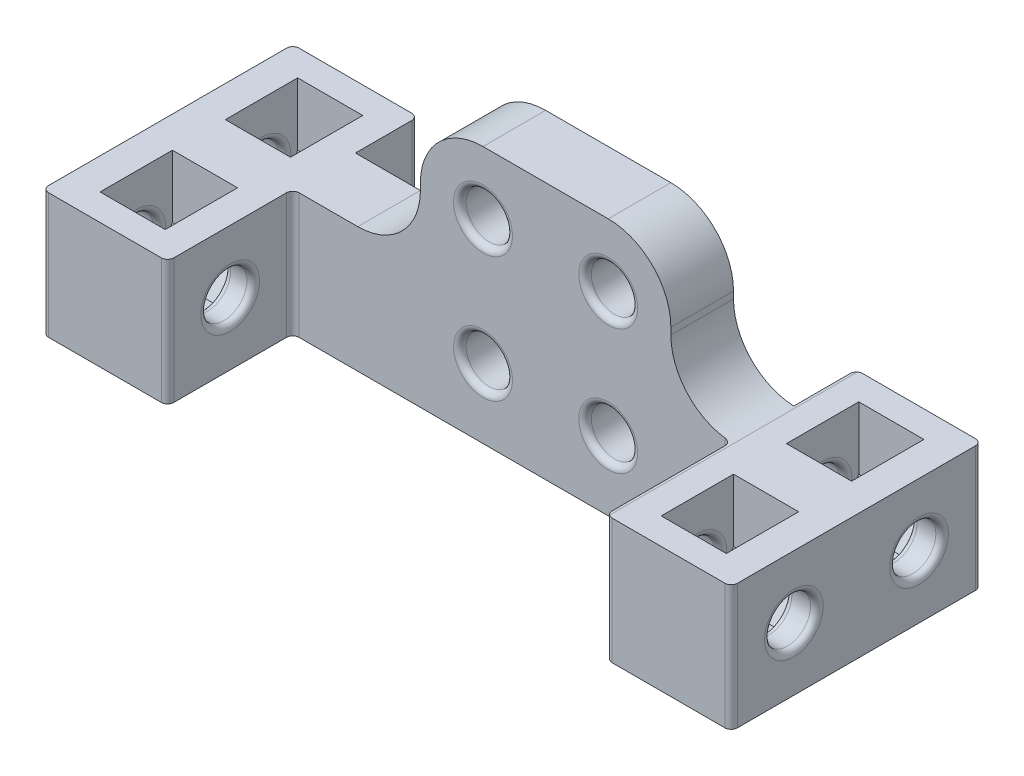
from build123d import *

# Parameters (mm, degrees)
SKETCH1_R           = 2.3495
BOSS_EXTRUDE1_DEPTH = 3.175
SKETCH2_W           = 12.7
SKETCH2_H           = 12.7
BOSS_EXTRUDE2_DEPTH = 12.7
SKETCH4_R           = 2.3368
CUT_EXTRUDE1_DEPTH  = 19.05
CUT_EXTRUDE2_START  = -50.8
SKETCH4_2_R         = 2.3368
CUT_EXTRUDE2_DEPTH  = 19.05
CUT_EXTRUDE3_START  = -3.175
CUT_EXTRUDE3_DEPTH  = 6.604
FILLET1_R           = 0.635
FILLET2_R           = 6.35
FILLET3_R           = 0.635


with BuildPart() as part:
    # Sketch1 → Boss-Extrude1 (new, symmetric)
    with BuildSketch(Plane.XY):
        Polygon((-34.925, -13.042622959), (34.925, -13.042622959), (34.925, -0.342622959), (16.110000038, -0.342622959), (16.110000038, 13.042622959), (-9.289999962, 13.042622959), (-9.289999962, -0.342622959), (-34.925, -0.342622959), align=None)
        with Locations((-2.939999962, 6.692622959)):
            Circle(SKETCH1_R, mode=Mode.SUBTRACT)
        with Locations((9.760000038, 6.692622959)):
            Circle(SKETCH1_R, mode=Mode.SUBTRACT)
        with Locations((9.760000038, -6.007377041)):
            Circle(SKETCH1_R, mode=Mode.SUBTRACT)
        with Locations((-2.939999962, -6.007377041)):
            Circle(SKETCH1_R, mode=Mode.SUBTRACT)
    extrude(amount=BOSS_EXTRUDE1_DEPTH, both=True)

    # Sketch2 → Boss-Extrude2 (add, symmetric)
    with BuildSketch(Plane(origin=(0, 0, -3.175), x_dir=(-1, 0, 0), z_dir=(0, 0, -1))):
        with Locations((28.575, -6.692622959)):
            Rectangle(SKETCH2_W, SKETCH2_H)
        with Locations((-28.575, -6.692622959)):
            Rectangle(SKETCH2_W, SKETCH2_H)
    extrude(amount=BOSS_EXTRUDE2_DEPTH, both=True)

    # Sketch4 → Cut-Extrude1 (cut)
    with BuildSketch(Plane.ZY.offset(34.925)):
        with Locations((-9.525, -6.692622959)):
            Circle(SKETCH4_R)
        with Locations((3.175, -6.692622959)):
            Circle(SKETCH4_R)
    extrude(amount=-CUT_EXTRUDE1_DEPTH, mode=Mode.SUBTRACT)

    # Sketch4<2> → Cut-Extrude2 (cut)
    with BuildSketch(Plane.ZY.offset(34.925).offset(CUT_EXTRUDE2_START)):
        with Locations((-9.525, -6.692622959)):
            Circle(SKETCH4_2_R)
        with Locations((3.175, -6.692622959)):
            Circle(SKETCH4_2_R)
    extrude(amount=-CUT_EXTRUDE2_DEPTH, mode=Mode.SUBTRACT)

    # Sketch5 → Cut-Extrude3 (cut)
    with BuildSketch(Plane.ZY.offset(34.925).offset(CUT_EXTRUDE3_START)):
        Polygon((-13.191174209, -6.692622959), (-13.191174209, 2.602121023), (-5.858825791, 2.602121023), (-5.858825791, -6.692622959), (-7.691912895, -9.867622959), (-11.358087105, -9.867622959), align=None)
        Polygon((-0.491174209, -6.692622959), (1.341912895, -9.867622959), (5.008087105, -9.867622959), (6.841174209, -6.692622959), (6.841174209, 3.296019963), (-0.491174209, 3.296019963), align=None)
    cut_extrude3 = extrude(amount=-CUT_EXTRUDE3_DEPTH, mode=Mode.SUBTRACT)

    # Mirror1: Cut-Extrude3 across plane
    add(cut_extrude3.mirror(Plane(origin=(0, 0, 0), x_dir=(0, 0, 1), z_dir=(1, 0, 0))), mode=Mode.SUBTRACT)

    # Fillet1
    fillet1_edges = [part.edges().sort_by_distance(p)[0] for p in [
        (22.225, -5.040255833, 4.827367126),
        (15.875, -6.692622959, 3.175),
        (34.925, -6.692622959, -11.8618),
        (22.225, -6.692622959, -11.8618),
        (19.05, -9.029422959, 3.175),
        (19.05, -4.355822959, 3.175),
        (34.925, -6.692622959, 0.8382),
        (15.875, -6.692622959, 0.8382),
        (-31.75, -6.692622959, -11.8618),
        (-25.146, -6.692622959, -11.8618),
        (-25.146, -6.692622959, 0.8382),
        (-31.75, -6.692622959, 0.8382),
        (25.146, -6.692622959, -11.8618),
        (31.75, -6.692622959, -11.8618),
        (25.146, -6.692622959, 0.8382),
        (31.75, -6.692622959, 0.8382),
        (-5.289499962, 6.692622959, -3.175),
        (-5.289499962, 6.692622959, 3.175),
        (7.410500038, 6.692622959, -3.175),
        (7.410500038, 6.692622959, 3.175),
        (7.410500038, -6.007377041, -3.175),
        (7.410500038, -6.007377041, 3.175),
        (-5.289499962, -6.007377041, -3.175),
        (-5.289499962, -6.007377041, 3.175),
        (-22.225, -8.344990085, 4.827367126),
        (-15.875, -6.692622959, 3.175),
        (-22.225, -6.692622959, -11.8618),
        (-34.925, -6.692622959, -11.8618),
        (-19.05, -4.355822959, 3.175),
        (-19.05, -9.029422959, 3.175),
        (-15.875, -6.692622959, 0.8382),
        (-34.925, -6.692622959, 0.8382),
    ]]
    fillet(fillet1_edges, radius=FILLET1_R)

    # Fillet2
    # the kernel refuses this fillet: 6.35 mm, written as the material it adds along each edge
    with BuildSketch(Plane(origin=(16.110000038, -0.342622959, -19.05), x_dir=(0, 1, 0), z_dir=(0, 0, 1))) as fillet2_piece_1_section:
        with BuildLine():
            CenterArc((FILLET2_R, -FILLET2_R), FILLET2_R, 90, 90)
            Line((0, -FILLET2_R), (0, 0))
            Line((0, 0), (FILLET2_R, 0))
        make_face()
    fillet2_piece_1 = extrude(amount=22.225, mode=Mode.PRIVATE)
    fillet2_piece_1 = split(fillet2_piece_1, bisect_by=Plane(origin=(22.34183688, -0.405391526, -3.175), z_dir=(0, 0, -1)), keep=Keep.TOP, mode=Mode.PRIVATE)
    fillet2_piece_1 = split(fillet2_piece_1, bisect_by=Plane(origin=(22.225, -0.405391526, -9.525), z_dir=(1, 0, 0)), keep=Keep.TOP, mode=Mode.PRIVATE)
    fillet2_piece_1 = split(fillet2_piece_1, bisect_by=Plane(origin=(22.34183688, -0.405391526, -15.875), z_dir=(0, 0, 1)), keep=Keep.TOP, mode=Mode.PRIVATE)
    add(fillet2_piece_1)
    with BuildSketch(Plane(origin=(16.110000038, -0.342622959, -3.175), x_dir=(0, 1, 0), z_dir=(0, 0, 1))) as fillet2_piece_2_section:
        with BuildLine():
            CenterArc((FILLET2_R, -FILLET2_R), FILLET2_R, 90, 90)
            Line((0, -FILLET2_R), (0, 0))
            Line((0, 0), (FILLET2_R, 0))
        make_face()
    fillet2_piece_2 = extrude(amount=6.35, mode=Mode.PRIVATE)
    fillet2_piece_2 = split(fillet2_piece_2, bisect_by=Plane(origin=(22.225, 1.099403632, 0), z_dir=(-1, 0, 0)), keep=Keep.TOP, mode=Mode.PRIVATE)
    add(fillet2_piece_2)
    with BuildSketch(Plane(origin=(16.110000038, -0.342622959, -3.175), x_dir=(0, 1, 0), z_dir=(0, 0, 1))) as fillet2_piece_3_section:
        with BuildLine():
            CenterArc((FILLET2_R, -FILLET2_R), FILLET2_R, 90, 90)
            Line((0, -FILLET2_R), (0, 0))
            Line((0, 0), (FILLET2_R, 0))
        make_face()
    fillet2_piece_3 = extrude(amount=6.35, mode=Mode.PRIVATE)
    fillet2_piece_3 = split(fillet2_piece_3, bisect_by=Plane(origin=(22.225, -0.405391526, 0), z_dir=(1, 0, 0)), keep=Keep.TOP, mode=Mode.PRIVATE)
    add(fillet2_piece_3)
    with BuildSketch(Plane(origin=(16.110000038, -0.342622959, -3.175), x_dir=(0, 1, 0), z_dir=(0, 0, 1))) as fillet2_piece_4_section:
        with BuildLine():
            CenterArc((FILLET2_R, -FILLET2_R), FILLET2_R, 90, 90)
            Line((0, -FILLET2_R), (0, 0))
            Line((0, 0), (FILLET2_R, 0))
        make_face()
    fillet2_piece_4 = extrude(amount=22.225, mode=Mode.PRIVATE)
    fillet2_piece_4 = split(fillet2_piece_4, bisect_by=Plane(origin=(22.34183688, -0.405391526, 3.175), z_dir=(0, 0, 1)), keep=Keep.TOP, mode=Mode.PRIVATE)
    fillet2_piece_4 = split(fillet2_piece_4, bisect_by=Plane(origin=(22.225, -0.405391526, 6.35), z_dir=(1, 0, 0)), keep=Keep.TOP, mode=Mode.PRIVATE)
    fillet2_piece_4 = split(fillet2_piece_4, bisect_by=Plane(origin=(22.34183688, -0.405391526, 9.525), z_dir=(0, 0, -1)), keep=Keep.TOP, mode=Mode.PRIVATE)
    add(fillet2_piece_4)
    with BuildSketch(Plane(origin=(-9.289999962, -0.342622959, 3.175), x_dir=(0, 1, 0), z_dir=(0, 0, -1))) as fillet2_piece_5:
        with BuildLine():
            CenterArc((FILLET2_R, -FILLET2_R), FILLET2_R, 90, 90)
            Line((0, -FILLET2_R), (0, 0))
            Line((0, 0), (FILLET2_R, 0))
        make_face()
    extrude(amount=6.35)
    # the kernel refuses this fillet: 6.35 mm, written as the material it takes off along each edge
    with BuildSketch(Plane(origin=(-9.289999962, 13.042622959, -19.05), x_dir=(0, -1, 0), z_dir=(0, 0, 1)), Plane(origin=(16.110000038, 13.042622959, -19.05), x_dir=(-1, 0, 0), z_dir=(0, 0, 1))) as fillet2_2_piece_1:
        with BuildLine():
            CenterArc((FILLET2_R, FILLET2_R), FILLET2_R, 180, 90)
            Line((0, FILLET2_R), (0, 0))
            Line((0, 0), (FILLET2_R, 0))
        make_face()
    extrude(amount=38.1, mode=Mode.SUBTRACT)

    # Fillet3
    fillet3_edges = [part.edges().sort_by_distance(p)[0] for p in [
        (34.925, -6.692622959, -15.875),
        (22.225, -6.690448001, -15.875),
        (22.225, -6.690448001, -3.175),
        (-22.225, -6.692622959, -3.175),
        (-22.225, -6.692622959, -15.875),
        (-34.925, -6.692622959, 9.525),
        (-22.225, -6.692622959, 9.525),
        (22.225, -6.690448001, 9.525),
        (34.925, -6.692622959, 9.525),
        (-34.925, -6.692622959, -15.875),
    ]]
    fillet(fillet3_edges, radius=FILLET3_R)


with BuildPart() as body_2:
    # Mirror2: mirrored copy
    add(part.part.mirror(Plane(origin=(0, 0, -15.875), x_dir=(1, 0, 0), z_dir=(0, 0, -1))))


solid = body_2.part
